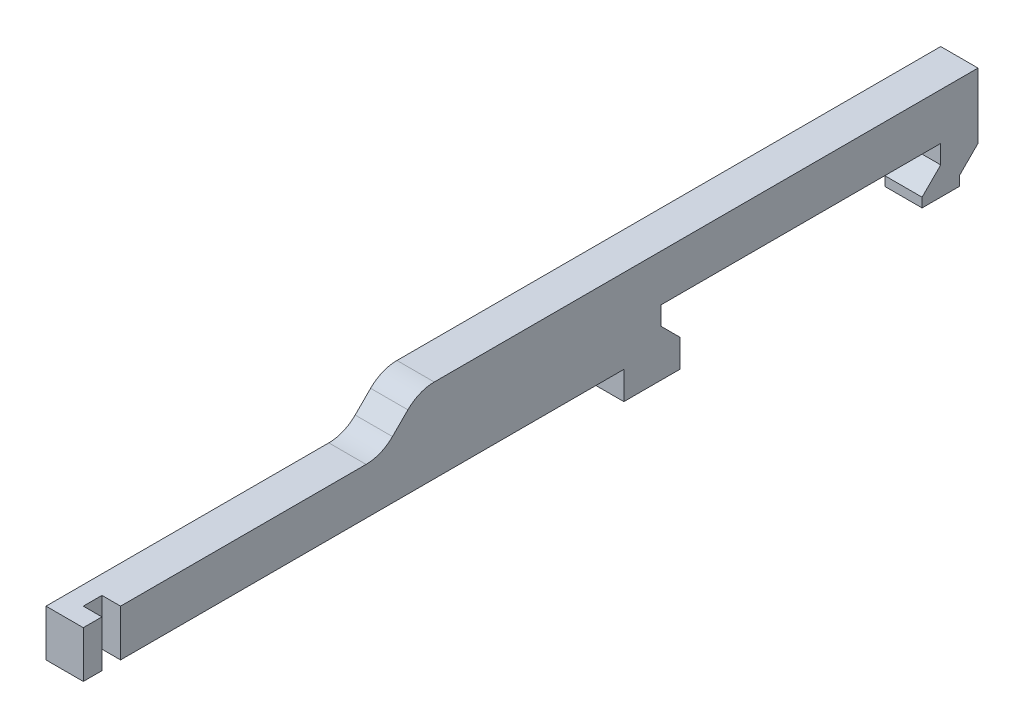
from build123d import *

# Parameters (mm, degrees)
EXTRUDE_1_DEPTH     = 2
FILLET_1_R          = 2
SKETCH_2_W          = 1
SKETCH_2_H          = 1
CUT_EXTRUDE_1_DEPTH = 49.207883173


with BuildPart() as part:
    # Эскиз1 → Бобышка-Вытянуть1 (new body)
    with BuildSketch(Plane(origin=(0, 0, 0), x_dir=(0, 0, -1), z_dir=(1, 0, 0))):
        Polygon((0, 0), (29, 0), (29, -1.5), (32, -1.5), (32, 0), (31, 1), (31, 2), (46, 2), (46, 1), (45, 0), (45, -0.5), (47, -0.5), (47, 0), (48, 1), (48, 4.5), (18, 4.5), (16, 2.5), (0, 2.5), align=None)
    extrude(amount=EXTRUDE_1_DEPTH)

    # Скругление1
    fillet_1_edges = [part.edges().sort_by_distance(p)[0] for p in [
        (1, 4.5, -18),
        (1, 2.5, -16),
    ]]
    fillet(fillet_1_edges, radius=FILLET_1_R)

    # Эскиз2 → Вырез-Вытянуть1 (cut, through all)
    with BuildSketch(Plane(origin=(0, 2.5, 0), x_dir=(1, 0, 0), z_dir=(0, 1, 0))):
        with Locations((1.5, 1.5)):
            Rectangle(SKETCH_2_W, SKETCH_2_H)
    extrude(amount=-CUT_EXTRUDE_1_DEPTH, mode=Mode.SUBTRACT)


solid = part.part
